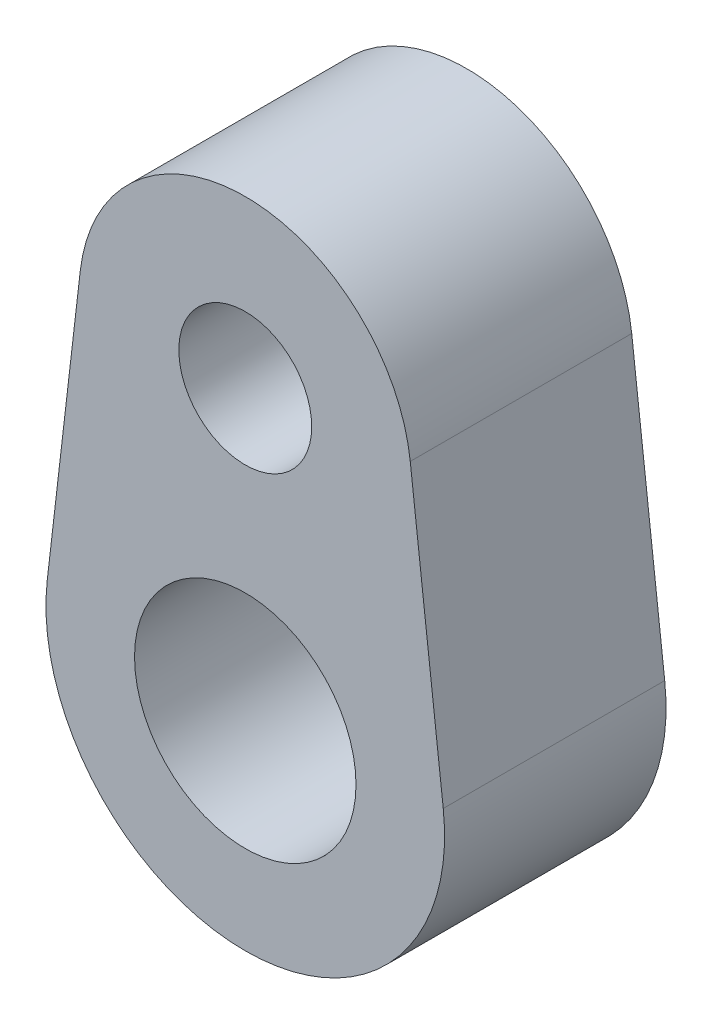
from build123d import *

# Parameters (mm, degrees)
SKETCH_1_R      = 3
SKETCH_1_R_2    = 5
EXTRUDE_1_DEPTH = 5


# Read off the part's stored shape, not the designer's step: M5 螺纹孔1
with BuildPart() as part:
    # 草图1 → 凸台-拉伸1 (new, symmetric)
    with BuildSketch(Plane.XY):
        with BuildLine():
            Line((8.93988801, 1.038461538), (7.449906675, 13.865384615))
            ThreePointArc((7.449906675, 13.865384615), (0, 20.5), (-7.449906675, 13.865384615))
            Line((-7.449906675, 13.865384615), (-8.93988801, 1.038461538))
            ThreePointArc((-8.93988801, 1.038461538), (0, -9), (8.93988801, 1.038461538))
        make_face()
        with Locations((0, 13)):
            Circle(SKETCH_1_R, mode=Mode.SUBTRACT)
        Circle(SKETCH_1_R_2, mode=Mode.SUBTRACT)
    extrude(amount=EXTRUDE_1_DEPTH, both=True)

    # M5 螺纹孔1 outline → M5 螺纹孔1 (revolve, cut)
    with BuildSketch(Plane(origin=(0, 0, 0), x_dir=(0.707106781186549, 0.707106781186546, 0), z_dir=(0, 0, -1))):
        Polygon((2.1, -4.315295433), (2.1, -5.425), (2.525, -5), (2.525, -4.315295433), align=None)
        Polygon((2.1, -13.143744736), (2.1, -5.425), (2.1, -4.315295433), (0, -4.315295433), (0, -13.143744736), align=None)
    revolve(axis=Axis((0, 0, 0), (0.707106781186546, -0.707106781186549, 0)), mode=Mode.SUBTRACT)


solid = part.part
